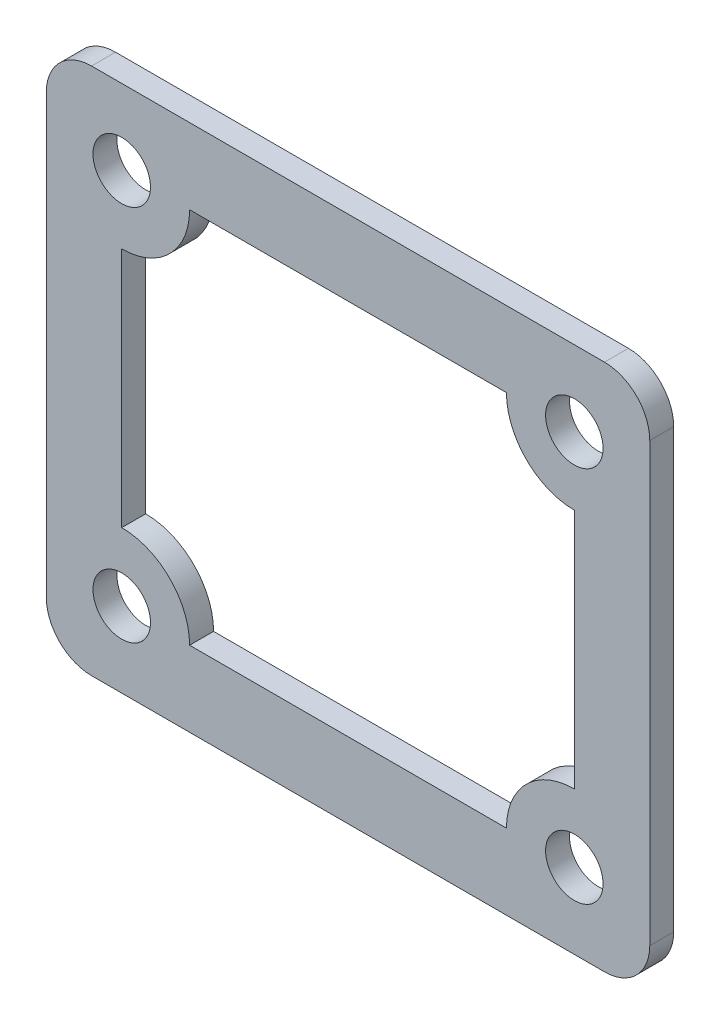
from build123d import *

# Parameters (mm, degrees)
SKETCH1_W           = 40
SKETCH1_H           = 35
SKETCH1_R           = 1.905
BOSS_EXTRUDE1_DEPTH = 1.5875
FILLET1_R           = 3


with BuildPart() as part:
    # Sketch1 → Boss-Extrude1 (new body)
    with BuildSketch(Plane.XY):
        Rectangle(SKETCH1_W, SKETCH1_H)
        with Locations((-15, -12.5)):
            Circle(SKETCH1_R, mode=Mode.SUBTRACT)
        with Locations((15, -12.5)):
            Circle(SKETCH1_R, mode=Mode.SUBTRACT)
        with Locations((15, 12.5)):
            Circle(SKETCH1_R, mode=Mode.SUBTRACT)
        with Locations((-15, 12.5)):
            Circle(SKETCH1_R, mode=Mode.SUBTRACT)
        with BuildLine():
            Line((-15, 8), (-15, -8))
            ThreePointArc((-15, -8), (-11.818019485, -9.318019485), (-10.5, -12.5))
            Line((-10.5, -12.5), (10.5, -12.5))
            ThreePointArc((10.5, -12.5), (11.818019485, -9.318019485), (15, -8))
            Line((15, -8), (15, 8))
            ThreePointArc((15, 8), (11.818019485, 9.318019485), (10.5, 12.5))
            Line((10.5, 12.5), (-10.5, 12.5))
            ThreePointArc((-10.5, 12.5), (-11.818019485, 9.318019485), (-15, 8))
        make_face(mode=Mode.SUBTRACT)
    extrude(amount=BOSS_EXTRUDE1_DEPTH)

    # Fillet1
    fillet1_edges = [part.edges().sort_by_distance(p)[0] for p in [
        (20, 17.5, 0.79375),
        (-20, 17.5, 0.79375),
        (-20, -17.5, 0.79375),
        (20, -17.5, 0.79375),
    ]]
    fillet(fillet1_edges, radius=FILLET1_R)


solid = part.part
